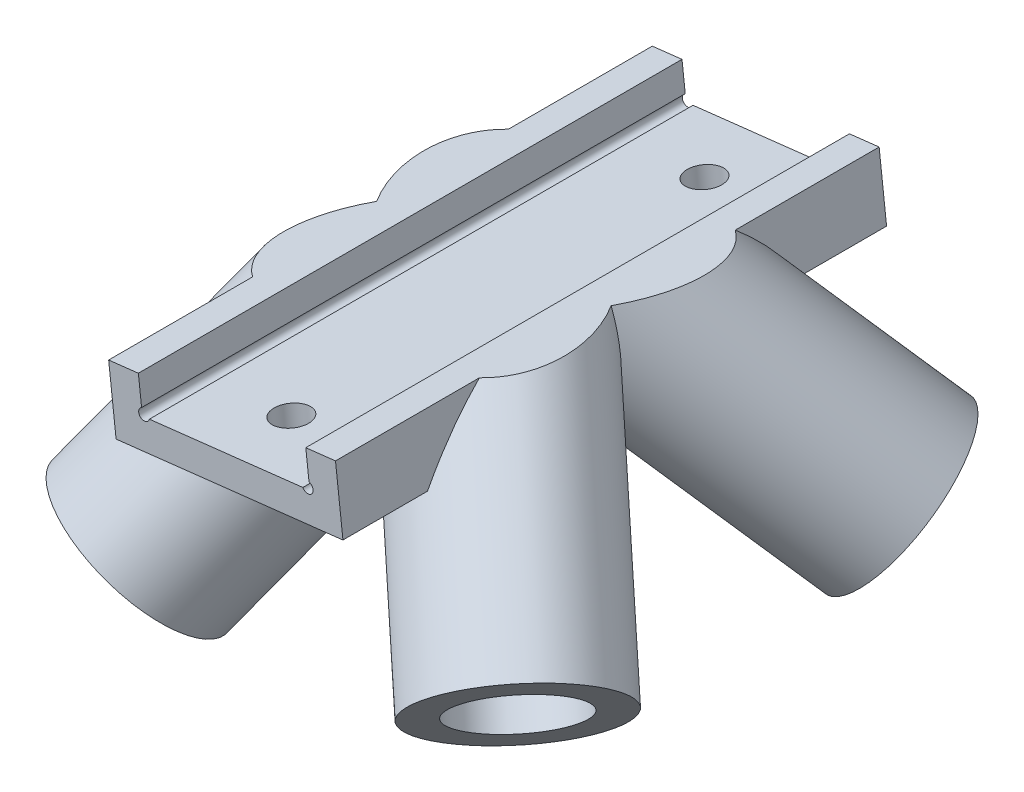
from build123d import *

# Parameters (mm, degrees)
BOSS_EXTRUDE1_DEPTH = 25
SKETCH5_R           = 8
BOSS_EXTRUDE2_DEPTH = 35
SKETCH6_R           = 8
BOSS_EXTRUDE3_DEPTH = 35
CUT_EXTRUDE1_DEPTH  = 35
SKETCH9_R           = 5.1
CUT_EXTRUDE2_DEPTH  = 17
SKETCH10_R          = 5.1
CUT_EXTRUDE3_DEPTH  = 17
SKETCH11_R          = 0.5
CUT_EXTRUDE4_DEPTH  = 49.48192396
CUT_EXTRUDE5_REACH  = 44.001
SKETCH12_R          = 1.6
CUT_EXTRUDE7_DEPTH  = 66.003822587


# Read off the part's stored shape, not the designer's step: Mirror1
with BuildPart() as part:
    # Sketch3 → Boss-Extrude1 (new body)
    with BuildSketch(Plane(origin=(0, 0, 0), x_dir=(-0.9678879191476432, 0.2513821313618881, 0), z_dir=(0, 0, 1))):
        Polygon((-6.013757892, -13.576992157), (13.576992157, -6.013757892), (6.013757892, 13.576992157), (-13.576992157, 6.013757892), align=None)
    extrude(amount=BOSS_EXTRUDE1_DEPTH)

    # Sketch5 → Boss-Extrude2 (add)
    with BuildSketch(Plane(origin=(0, 0, 0), x_dir=(-0.6605627762289513, -0.729230336843708, -0.17854952950795708), z_dir=(0.5774000057119382, -0.6454527352206789, 0.499999999999998))):
        with Locations(Location((0, 0, 0), (0, 0, 168.101929209))):
            Circle(SKETCH5_R)
    extrude(amount=BOSS_EXTRUDE2_DEPTH)

    # Sketch6 → Boss-Extrude3 (add)
    with BuildSketch(Plane(origin=(0, 0, 0), x_dir=(-0.7035639492311271, 0.6172392366079582, 0.3521554970945721), z_dir=(-0.4160720061092846, -0.7595288577349762, 0.499999999999998))):
        with Locations(Location((0, 0, 0), (0, 0, 312.286757046))):
            Circle(SKETCH6_R)
    extrude(amount=BOSS_EXTRUDE3_DEPTH)

    # Sketch8 → Cut-Extrude1 (cut)
    with BuildSketch(Plane(origin=(0, 0, 0), x_dir=(-0.9678879191476432, 0.2513821313618881, 0), z_dir=(0, 0, 1))):
        Polygon((-36.845563498, -70.986857451), (-76.079837432, 33.240527854), (43.363854901, 78.202670298), (82.598128835, -26.024715007), align=None)
    extrude(amount=-CUT_EXTRUDE1_DEPTH, mode=Mode.SUBTRACT)

    # Sketch9 → Cut-Extrude2 (cut)
    with BuildSketch(Plane(origin=(20.2090002, -22.590845733, 17.5), x_dir=(0.6605627762289512, 0.7292303368437081, 0.1785495295079571), z_dir=(0.5774000057119382, -0.6454527352206788, 0.499999999999998))):
        with Locations(Location((0, 0, 0), (0, 0, 348.101929209))):
            Circle(SKETCH9_R)
    extrude(amount=-CUT_EXTRUDE2_DEPTH, mode=Mode.SUBTRACT)

    # Sketch10 → Cut-Extrude3 (cut)
    with BuildSketch(Plane(origin=(-14.562520214, -26.583510021, 17.5), x_dir=(-0.7035639492311272, 0.6172392366079582, 0.352155497094572), z_dir=(-0.41607200610928446, -0.7595288577349761, 0.499999999999998))):
        with Locations(Location((0, 0, 0), (0, 0, 129.311285717))):
            Circle(SKETCH10_R)
    extrude(amount=-CUT_EXTRUDE3_DEPTH, mode=Mode.SUBTRACT)

    # Sketch11 → Cut-Extrude4 (cut, through all)
    with BuildSketch(Plane(origin=(0, 0, 25), x_dir=(0.967887919147643, -0.25138213136188803, 0), z_dir=(0, 0, 1))):
        with BuildLine():
            ThreePointArc((-3.837479182, -9.792532706), (-3.837482303, -9.790766245), (-3.837491664, -9.788999807))
            Line((-3.837491664, -9.788999807), (-4.438726063, -10.021113258))
            Line((-4.438726063, -10.021113258), (-4.670839514, -9.419878859))
            ThreePointArc((-4.670839514, -9.419878859), (-4.541586794, -10.248975564), (-3.837479182, -9.792532706))
        make_face()
        with BuildLine():
            Line((-4.438726063, -10.021113258), (-3.837491664, -9.788999807))
            ThreePointArc((-3.837491664, -9.788999807), (-4.134985421, -9.3353716), (-4.670839514, -9.419878859))
            Line((-4.670839514, -9.419878859), (-4.438726063, -10.021113258))
        make_face()
        with BuildLine():
            Line((9.419878859, -4.670839514), (10.021113258, -4.438726063))
            Line((10.021113258, -4.438726063), (9.788999807, -3.837491664))
            ThreePointArc((9.788999807, -3.837491664), (9.3353716, -4.134985421), (9.419878859, -4.670839514))
        make_face()
        with BuildLine():
            Line((9.788999807, -3.837491664), (10.021113258, -4.438726063))
            Line((10.021113258, -4.438726063), (9.419878859, -4.670839514))
            ThreePointArc((9.419878859, -4.670839514), (9.97096067, -4.804558899), (10.292532706, -4.337479182))
            ThreePointArc((10.292532706, -4.337479182), (10.144834814, -3.982678922), (9.788999807, -3.837491664))
        make_face()
        with Locations((-4.337479182, -9.792532706)):
            Circle(SKETCH11_R)
        with Locations((9.792532706, -4.337479182)):
            Circle(SKETCH11_R)
        Polygon((-4.438726063, -10.021113258), (10.021113258, -4.438726063), (4.438726063, 10.021113258), (-10.021113258, 4.438726063), align=None)
    extrude(amount=-CUT_EXTRUDE4_DEPTH, mode=Mode.SUBTRACT)

    # Sketch12 → Cut-Extrude5 (cut, up to next)
    with BuildSketch(Plane(origin=(1.197799286, -10.431456124, 0), x_dir=(0.07381782244775265, 0.008476183382208579, -0.9972357210832067), z_dir=(-0.11407612251429676, 0.9934720118212205, 0)), mode=Mode.PRIVATE) as cut_extrude5_sk1:
        with Locations(Location((-18.947478701, -1.411754543, 0), (0, 0, 274.261167974))):
            Circle(SKETCH12_R)
    cut_extrude5_tool1 = extrude(cut_extrude5_sk1.sketch, amount=CUT_EXTRUDE5_REACH, mode=Mode.PRIVATE) & part.part
    add(cut_extrude5_tool1.solids().sort_by_distance((1.197799, -10.431456, 19))[0], mode=Mode.SUBTRACT)

    # Mirror1: part across plane


with BuildPart() as part_1:
    add(part.part)
    add(part.part.mirror(Plane.XY))

    # Sketch14 → Cut-Extrude7 (cut, through all)
    with BuildSketch(Plane.XY.offset(25)):
        Polygon((-31.040805359, -8.093851281), (38.274007484, -0.134729143), (36.078976394, 18.981470679), (-33.745248602, 10.963854933), align=None)
    extrude(amount=-CUT_EXTRUDE7_DEPTH, mode=Mode.SUBTRACT)


solid = part_1.part
